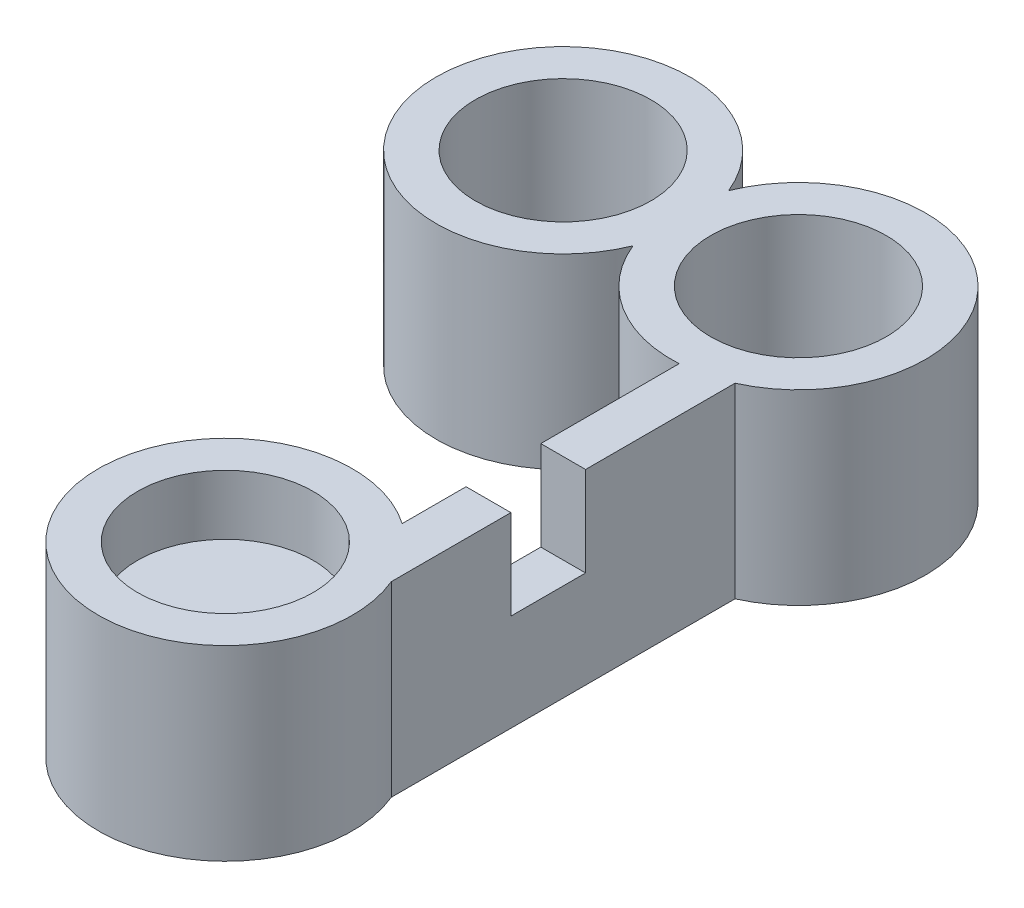
from build123d import *

# Parameters (mm, degrees)
SKETCH1_R           = 2.9845
BOSS_EXTRUDE1_DEPTH = 6.35
SKETCH2_W           = 2.54
SKETCH2_H           = 3.048
CUT_EXTRUDE1_DEPTH  = 6.35
SKETCH3_R           = 2.9845
BOSS_EXTRUDE2_DEPTH = 4.318


with BuildPart() as part:
    # Sketch1 → Boss-Extrude1 (new body)
    with BuildSketch(Plane(origin=(0, 0, 0), x_dir=(1, 0, 0), z_dir=(0, 1, 0))):
        with BuildLine():
            Line((-2.032, 17.14704892), (-2.032, 5.46304892))
            ThreePointArc((-2.032, 5.46304892), (-9.383934319, 1.101465123), (-3.556, 7.355226633))
            Line((-3.556, 7.355226633), (-3.556, 16.771477062))
            ThreePointArc((-3.556, 16.771477062), (-6.114748984, 17.430526856), (-7.8105, 19.456846546))
            ThreePointArc((-7.8105, 19.456846546), (-16.129, 21.082), (-7.8105, 22.707153454))
            ThreePointArc((-7.8105, 22.707153454), (-0.816078296, 24.193520019), (-2.032, 17.14704892))
        make_face()
        with Locations((-11.811, 21.082)):
            Circle(SKETCH1_R, mode=Mode.SUBTRACT)
        with Locations((-3.81, 21.082)):
            Circle(SKETCH1_R, mode=Mode.SUBTRACT)
        with Locations((-6.021054182, 3.81)):
            Circle(SKETCH1_R, mode=Mode.SUBTRACT)
    extrude(amount=BOSS_EXTRUDE1_DEPTH)

    # Sketch2 → Cut-Extrude1 (cut)
    with BuildSketch(Plane(origin=(-2.032, 0, 0), x_dir=(0, 0, -1), z_dir=(1, 0, 0))):
        with Locations((10.79704892, 4.826)):
            Rectangle(SKETCH2_W, SKETCH2_H)
    extrude(amount=-CUT_EXTRUDE1_DEPTH, mode=Mode.SUBTRACT)

    # Sketch3 → Boss-Extrude2 (add)
    with BuildSketch(Plane(origin=(0, 0, 0), x_dir=(1, 0, 0), z_dir=(0, 1, 0))):
        with Locations((-6.021054182, 3.81)):
            Circle(SKETCH3_R)
    extrude(amount=BOSS_EXTRUDE2_DEPTH)


solid = part.part
